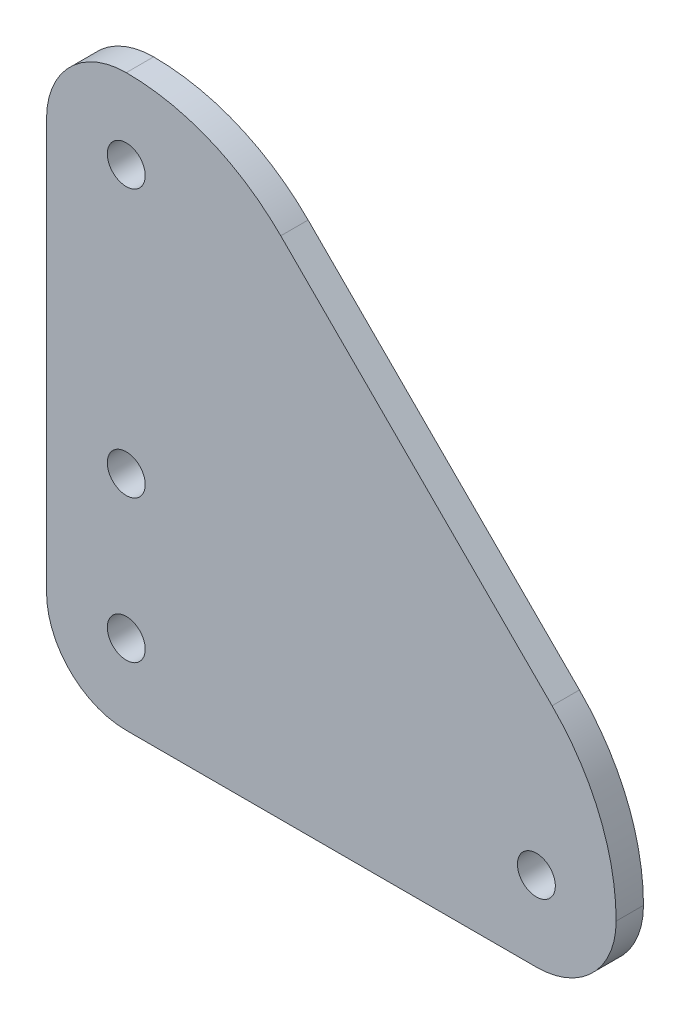
from build123d import *

# Parameters (mm, degrees)
BOSS_EXTRUDE1_DEPTH      = 3
FILLET1_R                = 21.5
FILLET2_R                = 52
CUT_EXTRUDE1_DEPTH       = 189.18607812481773
F_5_16_CLEARANCE_HOLE1_D = 8.3185


with BuildPart() as part:
    # Sketch1 → Boss-Extrude1 (new, symmetric)
    with BuildSketch(Plane.XY):
        Polygon((0, 0), (0, 133), (42.999999999999986, 133), (133, 42.99999999999999), (133, 9.06e-15), align=None)
    extrude(amount=BOSS_EXTRUDE1_DEPTH, both=True)

    # Fillet1
    fillet1_edges = [part.edges().sort_by_distance(p)[0] for p in [
        (0, 0, 0),
        (0, 133, 0),
        (133, 9.06e-15, 0),
    ]]
    fillet(fillet1_edges, radius=FILLET1_R)

    # Fillet2
    # the kernel refuses this fillet: 52 mm, written as the material it takes off along each edge
    with BuildSketch(Plane(origin=(133, 43, -56.84767436170304), x_dir=(-0.7071067811865476, 0.7071067811865476, 0), z_dir=(0, 0, 1))) as fillet2_piece_1:
        with BuildLine():
            CenterArc((21.539069744681207, 52.00000000000001), FILLET2_R, 225.07350833515432, 44.926491664845685)
            Line((-15.183278672480162, 15.183303696167892), (-18.855513514196304, 11.501634065784673))
            ThreePointArc((-18.855513514196304, 11.501634065784673), (-18.87975105768081, 11.52584053334073), (-3.6769552621700394, -3.6769552621700394))
            Line((-3.6769552621700394, -3.6769552621700394), (-4.9e-15, -5.200000000000005))
            Line((-4.9e-15, -5.200000000000005), (21.539069744681218, -5.199999999999996))
            Line((21.539069744681218, -5.199999999999996), (21.539069744681214, 4.7e-16))
        make_face()
    extrude(amount=113.69534872340608, mode=Mode.SUBTRACT)
    with BuildSketch(Plane(origin=(42.999999999999986, 133, 56.847674361702985), x_dir=(-0.9999999999996605, -8.240534738615283e-07, 0), z_dir=(0, 0, -1))) as fillet2_piece_2:
        with BuildLine():
            CenterArc((21.539173195539043, -51.9999571492017), FILLET2_R, 90.07355554994047, 44.926491664845685)
            Line((-15.230409726226513, -15.230434827591285), (-18.90736801840307, -11.55348259543025))
            Line((-18.90736801840307, -11.55348259543025), (-3.676958292176556, 3.6769522321610486))
            Line((-3.676958292176556, 3.6769522321610486), (-4.28507806408e-06, 5.199999999998223))
            ThreePointArc((-4.28507806408e-06, 5.199999999998223), (21.499995714914625, 5.200017717147912), (21.46574062621809, 5.1999957149201785))
            Line((21.46574062621809, 5.1999957149201785), (21.472416314338172, 0))
        make_face()
    extrude(amount=113.69534872340597, mode=Mode.SUBTRACT)

    # Sketch3 → Cut-Extrude1 (cut, through all)
    with BuildSketch(Plane.XY.offset(3)):
        with BuildLine():
            Line((117.76956733680983, 58.23043266319015), (58.23043266319017, 117.76956733680981))
            ThreePointArc((58.23043266319017, 117.76956733680981), (41.3784881824358, 129.03426172642116), (21.499999999999996, 133))
            ThreePointArc((21.499999999999996, 133), (6.2972042044892405, 126.70279579551078), (3.47e-15, 111.50000000000001))
            Line((3.47e-15, 111.50000000000001), (0, 21.5))
            ThreePointArc((0, 21.5), (6.297204204489223, 6.297204204489235), (21.49999999999999, 3.47e-15))
            Line((21.49999999999999, 3.47e-15), (111.50000000000001, 1.041e-14))
            ThreePointArc((111.50000000000001, 1.041e-14), (126.70279579551078, 6.297204204489239), (133, 21.500000000000007))
            ThreePointArc((133, 21.500000000000007), (129.03426172642114, 41.37848818243579), (117.76956733680983, 58.23043266319015))
        make_face()
        with BuildLine():
            Line((114.94114021206362, 55.40200553844396), (55.402005538443966, 114.94114021206363))
            ThreePointArc((55.402005538443966, 114.94114021206363), (39.84708125964561, 125.33902242576387), (21.49854269401705, 128.9999999393217))
            ThreePointArc((21.49854269401705, 128.9999999393217), (9.12511610449009, 123.87385342456624), (4.0000000000000036, 111.50000000000001))
            Line((4.0000000000000036, 111.50000000000001), (4, 21.500000000000004))
            ThreePointArc((4, 21.500000000000004), (9.125631329235414, 9.125631329235425), (21.499999999999996, 4.0000000000000036))
            Line((21.499999999999996, 4.0000000000000036), (111.50000000000001, 4.000000000000011))
            ThreePointArc((111.50000000000001, 4.000000000000011), (123.8738534245646, 9.125116104488455), (128.9999999393217, 21.49854269401244))
            ThreePointArc((128.9999999393217, 21.49854269401244), (125.33902242576474, 39.847081259643474), (114.94114021206362, 55.40200553844396))
        make_face(mode=Mode.SUBTRACT)
    extrude(amount=-CUT_EXTRUDE1_DEPTH, mode=Mode.SUBTRACT)


with BuildPart() as cut_extrude1_kept_piece:
    # of the separate pieces the step leaves, the one the design keeps (cut_extrude1_pieces_kept)
    add(part.part.solids().sort_by_distance((128.999999939, 21.498542694, -3))[0])

    # 5/16 Clearance Hole1 (through all)
    with Locations(Plane.XY.offset(3)):
        with Locations((21.5, 111.5), (21.5, 52.7884), (21.5, 21.5), (111.5, 21.5)):
            Hole(F_5_16_CLEARANCE_HOLE1_D / 2)


solid = cut_extrude1_kept_piece.part
